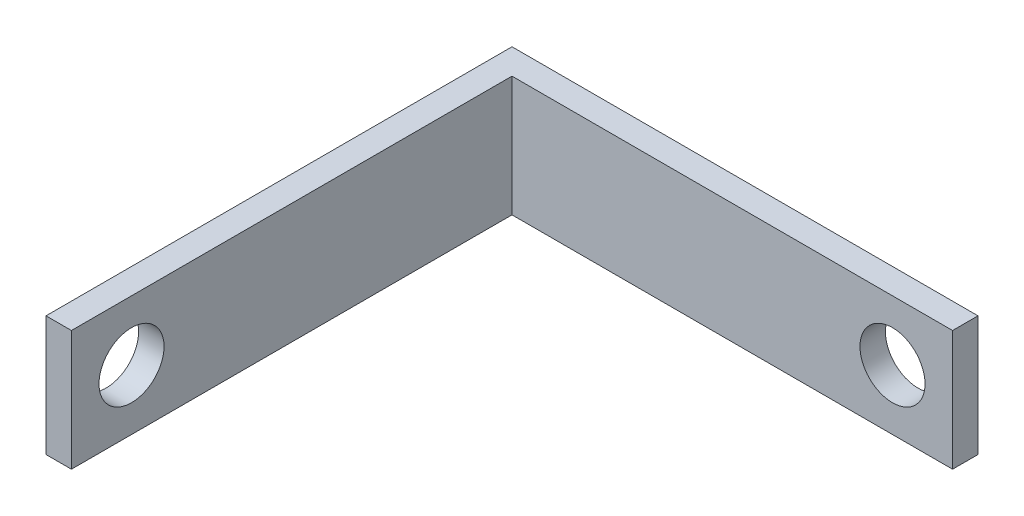
from build123d import *

# Parameters (mm, degrees)
BOSS_EXTRUDE1_DEPTH = 3.75
SKETCH2_R           = 2.03
CUT_EXTRUDE1_DEPTH  = 38.580598801
SKETCH3_R           = 2.03
CUT_EXTRUDE2_DEPTH  = 38.580598801


with BuildPart() as part:
    # Sketch1 → Boss-Extrude1 (new, symmetric)
    with BuildSketch(Plane(origin=(0, 0, 0), x_dir=(1, 0, 0), z_dir=(0, 1, 0))):
        Polygon((-23.75, 23.75), (-3.75, 23.75), (3.75, 23.75), (3.75, 25.3375), (-3.75, 25.3375), (-25.3375, 25.3375), (-25.3375, 3.75), (-25.3375, -3.75), (-23.75, -3.75), (-23.75, 3.75), align=None)
    extrude(amount=BOSS_EXTRUDE1_DEPTH, both=True)

    # Sketch2 → Cut-Extrude1 (cut, through all)
    with BuildSketch(Plane.XY.offset(-23.75)):
        Circle(SKETCH2_R)
    extrude(amount=-CUT_EXTRUDE1_DEPTH, mode=Mode.SUBTRACT)

    # Sketch3 → Cut-Extrude2 (cut, through all)
    with BuildSketch(Plane(origin=(-23.75, 0, 0), x_dir=(0, 0, -1), z_dir=(1, 0, 0))):
        Circle(SKETCH3_R)
    extrude(amount=-CUT_EXTRUDE2_DEPTH, mode=Mode.SUBTRACT)


solid = part.part
